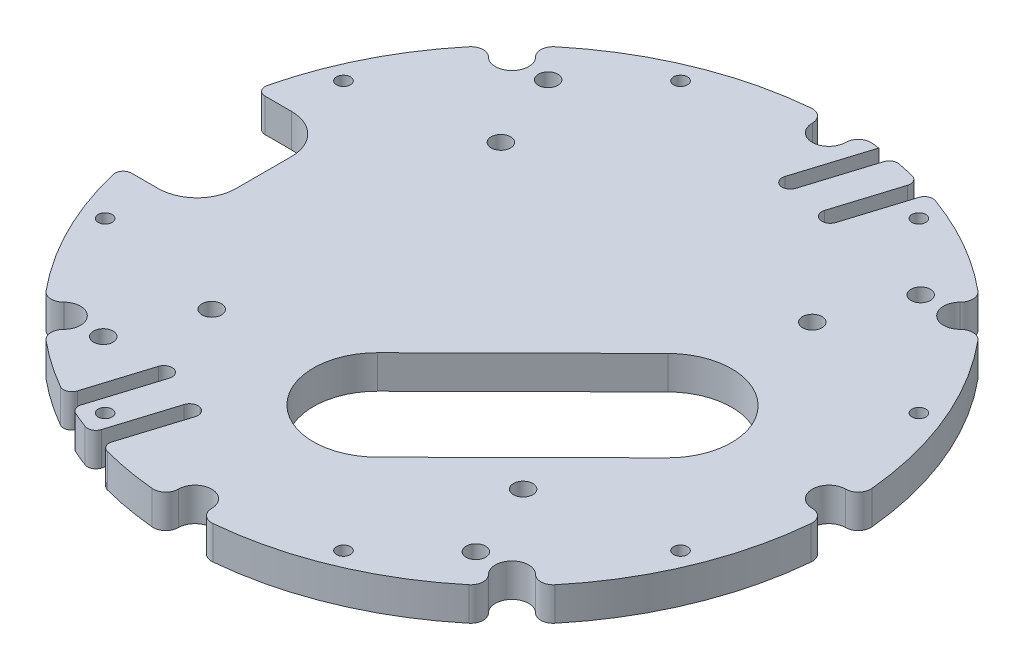
from build123d import *

# Parameters (mm, degrees)
SKIZZE1_R                       = 1.75
SKIZZE1_R_2                     = 1.25
AUFSATZ_LINEAR_AUSTRAGEN1_DEPTH = 6
SKIZZE2_R                       = 45
SKIZZE2_R_2                     = 43
SCHNITT_LINEAR_AUSTRAGEN1_DEPTH = 2
SCHNITT_LINEAR_AUSTRAGEN2_DEPTH = 184.594420289
VERRUNDUNG3_R                   = 1.5
VERRUNDUNG4_R                   = 1.5


with BuildPart() as part:
    # Skizze1 → Aufsatz-Linear austragen1 (new body)
    with BuildSketch(Plane(origin=(0, 90.400052662, 0), x_dir=(1, 0, 0), z_dir=(0, 1, 0))):
        with BuildLine():
            ThreePointArc((59.79229691, -34.576989423), (56.868043497, -33.855483754), (53.911025142, -33.282883624))
            Line((53.911025142, -33.282883624), (49.393275328, -47.783503714))
            ThreePointArc((49.393275328, -47.783503714), (47.883262768, -47.628044266), (46.36882647, -47.52417766))
            Line((46.36882647, -47.52417766), (50.937032463, -32.861608388))
            ThreePointArc((50.937032463, -32.861608388), (9.214097469, -43.752243823), (-14.195716657, -79.965360883))
            Line((-14.195716657, -79.965360883), (-7.542000561, -79.965360883))
            ThreePointArc((-7.542000561, -79.965360883), (-2.592253093, -82.015613415), (-0.542000561, -86.965360883))
            Line((-0.542000561, -86.965360883), (-0.542000561, -96.965360883))
            ThreePointArc((-0.542000561, -96.965360883), (-2.592253093, -101.915108352), (-7.542000561, -103.965360883))
            Line((-7.542000561, -103.965360883), (-14.195716657, -103.965360883))
            ThreePointArc((-14.195716657, -103.965360883), (-3.548828311, -127.624703737), (16.154215433, -144.504004759))
            Line((16.154215433, -144.504004759), (20.722421426, -129.841435487))
            ThreePointArc((20.722421426, -129.841435487), (22.02786149, -130.616117235), (23.358964294, -131.345823271))
            Line((23.358964294, -131.345823271), (18.84121448, -145.846443362))
            ThreePointArc((18.84121448, -145.846443362), (21.600192332, -147.054694026), (24.416778493, -148.121779241))
            Line((24.416778493, -148.121779241), (28.882198324, -133.789122679))
            ThreePointArc((28.882198324, -133.789122679), (30.317535649, -134.283199935), (31.768889486, -134.728034302))
            Line((31.768889486, -134.728034302), (27.306303406, -149.051595373))
            ThreePointArc((27.306303406, -149.051595373), (79.733549202, -139.601389133), (103.581637436, -91.965360883))
            ThreePointArc((103.581637436, -91.965360883), (92.289314353, -57.090299791), (62.69861605, -35.452901131))
            Line((62.69861605, -35.452901131), (58.23602997, -49.776462202))
            ThreePointArc((58.23602997, -49.776462202), (56.788846857, -49.318241066), (55.326877079, -48.909645985))
            Line((55.326877079, -48.909645985), (59.79229691, -34.576989423))
        make_face()
        with Locations(Location((10.581637436, -131.965360883, 0), (0, 0, 270))):
            Circle(SKIZZE1_R, mode=Mode.SUBTRACT)
        with Locations(Location((22.651365223, -143.702614704, 0), (0, 0, 270))):
            Circle(SKIZZE1_R_2, mode=Mode.SUBTRACT)
        with Locations(Location((-7.655616385, -113.395633096, 0), (0, 0, 270))):
            Circle(SKIZZE1_R_2, mode=Mode.SUBTRACT)
        with Locations(Location((16.081637436, -117.965360883, 0), (0, 0, 270))):
            Circle(SKIZZE1_R, mode=Mode.SUBTRACT)
        with Locations(Location((65.511909648, -143.702614704, 0), (0, 0, 270))):
            Circle(SKIZZE1_R_2, mode=Mode.SUBTRACT)
        with Locations(Location((77.581637436, -131.965360883, 0), (0, 0, 270))):
            Circle(SKIZZE1_R, mode=Mode.SUBTRACT)
        with Locations(Location((72.081637436, -117.965360883, 0), (0, 0, 270))):
            Circle(SKIZZE1_R, mode=Mode.SUBTRACT)
        with BuildLine():
            Line((37.760654604, -109.798791244), (63.984901036, -83.798791244))
            ThreePointArc((63.984901036, -83.798791244), (80.248207075, -83.868624484), (80.178373835, -100.131930523))
            Line((80.178373835, -100.131930523), (53.954127402, -126.131930523))
            ThreePointArc((53.954127402, -126.131930523), (37.690821363, -126.062097283), (37.760654604, -109.798791244))
        make_face(mode=Mode.SUBTRACT)
        with Locations(Location((95.818891256, -113.395633096, 0), (0, 0, 270))):
            Circle(SKIZZE1_R_2, mode=Mode.SUBTRACT)
        with Locations(Location((-7.655616385, -70.535088671, 0), (0, 0, 270))):
            Circle(SKIZZE1_R_2, mode=Mode.SUBTRACT)
        with Locations(Location((16.081637436, -65.965360883, 0), (0, 0, 270))):
            Circle(SKIZZE1_R, mode=Mode.SUBTRACT)
        with Locations(Location((10.581637436, -51.965360883, 0), (0, 0, 270))):
            Circle(SKIZZE1_R, mode=Mode.SUBTRACT)
        with Locations(Location((22.651365223, -40.228107063, 0), (0, 0, 270))):
            Circle(SKIZZE1_R_2, mode=Mode.SUBTRACT)
        with Locations(Location((72.081637436, -65.965360883, 0), (0, 0, 270))):
            Circle(SKIZZE1_R, mode=Mode.SUBTRACT)
        with Locations(Location((95.818891256, -70.535088671, 0), (0, 0, 270))):
            Circle(SKIZZE1_R_2, mode=Mode.SUBTRACT)
        with Locations(Location((65.511909648, -40.228107063, 0), (0, 0, 270))):
            Circle(SKIZZE1_R_2, mode=Mode.SUBTRACT)
        with Locations(Location((77.581637436, -51.965360883, 0), (0, 0, 270))):
            Circle(SKIZZE1_R, mode=Mode.SUBTRACT)
    extrude(amount=AUFSATZ_LINEAR_AUSTRAGEN1_DEPTH)

    # Skizze2 → Schnitt-Linear austragen1 (cut)
    with BuildSketch(Plane(origin=(0, 90.400052662, 0), x_dir=(1, 0, 0), z_dir=(0, 1, 0))):
        with Locations((44.081637436, -91.965360883)):
            Circle(SKIZZE2_R)
        with Locations(Location((44.081637436, -91.965360883, 0), (0, 0, 90))):
            Circle(SKIZZE2_R_2, mode=Mode.SUBTRACT)
    extrude(amount=SCHNITT_LINEAR_AUSTRAGEN1_DEPTH, mode=Mode.SUBTRACT)

    # Skizze3 → Schnitt-Linear austragen2 (cut, through all)
    with BuildSketch(Plane(origin=(0, 96.400052662, 0), x_dir=(1, 0, 0), z_dir=(0, 1, 0))):
        with BuildLine():
            ThreePointArc((5.897871252, -49.538954012), (5.238906143, -47.838492112), (6.051282368, -46.20574885))
            ThreePointArc((6.051282368, -46.20574885), (2.008783955, -49.892507403), (-1.677974597, -53.935005816))
            ThreePointArc((-1.677974597, -53.935005816), (-0.045231336, -53.122629591), (1.655230564, -53.781594699))
            ThreePointArc((1.655230564, -53.781594699), (5.897871252, -53.781594699), (5.897871252, -49.538954012))
        make_face()
        with BuildLine():
            ThreePointArc((49.547047449, -32.716906951), (44.081637436, -32.465360883), (38.616227422, -32.716906951))
            ThreePointArc((38.616227422, -32.716906951), (40.345187992, -33.296994046), (41.081637436, -34.965360883))
            ThreePointArc((41.081637436, -34.965360883), (44.081637436, -37.965360883), (47.081637436, -34.965360883))
            ThreePointArc((47.081637436, -34.965360883), (47.81808688, -33.296994046), (49.547047449, -32.716906951))
        make_face()
        with BuildLine():
            ThreePointArc((1.655230564, -130.149127067), (-0.045231336, -130.808092176), (-1.677974597, -129.995715951))
            ThreePointArc((-1.677974597, -129.995715951), (2.008783955, -134.038214364), (6.051282368, -137.724972916))
            ThreePointArc((6.051282368, -137.724972916), (5.238906143, -136.092229655), (5.897871252, -134.391767755))
            ThreePointArc((5.897871252, -134.391767755), (5.897871252, -130.149127067), (1.655230564, -130.149127067))
        make_face()
        with BuildLine():
            ThreePointArc((89.841249469, -53.935005816), (86.154490916, -49.892507403), (82.111992503, -46.20574885))
            ThreePointArc((82.111992503, -46.20574885), (82.924368728, -47.838492112), (82.26540362, -49.538954012))
            ThreePointArc((82.26540362, -49.538954012), (82.26540362, -53.781594699), (86.508044307, -53.781594699))
            ThreePointArc((86.508044307, -53.781594699), (88.208506207, -53.122629591), (89.841249469, -53.935005816))
        make_face()
        with BuildLine():
            ThreePointArc((103.330091368, -97.430770897), (103.581637436, -91.965360883), (103.330091368, -86.49995087))
            ThreePointArc((103.330091368, -86.49995087), (102.750004273, -88.228911439), (101.081637436, -88.965360883))
            ThreePointArc((101.081637436, -88.965360883), (98.081637436, -91.965360883), (101.081637436, -94.965360883))
            ThreePointArc((101.081637436, -94.965360883), (102.750004273, -95.701810327), (103.330091368, -97.430770897))
        make_face()
        with BuildLine():
            ThreePointArc((82.111992503, -137.724972916), (86.154490916, -134.038214364), (89.841249469, -129.995715951))
            ThreePointArc((89.841249469, -129.995715951), (88.208506207, -130.808092176), (86.508044307, -130.149127067))
            ThreePointArc((86.508044307, -130.149127067), (82.26540362, -130.149127067), (82.26540362, -134.391767755))
            ThreePointArc((82.26540362, -134.391767755), (82.924368728, -136.092229655), (82.111992503, -137.724972916))
        make_face()
        with BuildLine():
            ThreePointArc((38.616227422, -151.213814816), (44.081637436, -151.465360883), (49.547047449, -151.213814816))
            ThreePointArc((49.547047449, -151.213814816), (47.81808688, -150.633727721), (47.081637436, -148.965360883))
            ThreePointArc((47.081637436, -148.965360883), (44.081637436, -145.965360883), (41.081637436, -148.965360883))
            ThreePointArc((41.081637436, -148.965360883), (40.345187992, -150.633727721), (38.616227422, -151.213814816))
        make_face()
    extrude(amount=-SCHNITT_LINEAR_AUSTRAGEN2_DEPTH, mode=Mode.SUBTRACT)

    # Verrundung3
    # the kernel refuses this fillet: 1.5 mm, written as the material it adds along each edge
    with BuildSketch(Plane(origin=(20.722421426, 87.672861627, 129.841435487), x_dir=(-0.2974534732108493, 0, 0.9547363150497642), z_dir=(0, 1, 0))) as verrundung3_piece_1_section:
        with BuildLine():
            CenterArc((1.890876414, 1.5), VERRUNDUNG3_R, 168.036182017, 101.963817983)
            ThreePointArc((0.423458363, 1.810940931), (0.221190811, 0.903258021), (0, 0))
            Line((0, 0), (1.890876414, 0))
        make_face()
    verrundung3_piece_1 = extrude(amount=8.727191035, mode=Mode.PRIVATE)
    verrundung3_piece_1 = split(verrundung3_piece_1, bisect_by=Plane(origin=(20.59371333, 92.400052662, 130.786748956), z_dir=(0, -1, 0)), keep=Keep.TOP, mode=Mode.PRIVATE)
    verrundung3_piece_1 = verrundung3_piece_1 - Plane(origin=(44.081637436, 91.400052662, 91.965360883), x_dir=(1, 0, 0), z_dir=(0, -1, 0)) * Cylinder(45, 26, mode=Mode.PRIVATE)
    verrundung3_piece_1 = split(verrundung3_piece_1, bisect_by=Plane(origin=(20.59371333, 90.400052662, 130.786748956), z_dir=(0, 1, 0)), keep=Keep.TOP, mode=Mode.PRIVATE)
    add(verrundung3_piece_1)
    with BuildSketch(Plane(origin=(20.722421426, 92.400052662, 129.841435487), x_dir=(-0.2974534732108493, 0, 0.9547363150497642), z_dir=(0, 1, 0))) as verrundung3_piece_2_section:
        with BuildLine():
            CenterArc((1.890876414, 1.5), VERRUNDUNG3_R, 168.036182017, 101.963817983)
            ThreePointArc((0.423458363, 1.810940931), (0.221190811, 0.903258021), (0, 0))
            Line((0, 0), (1.890876414, 0))
        make_face()
    verrundung3_piece_2 = extrude(amount=4, mode=Mode.PRIVATE)
    verrundung3_piece_2 = verrundung3_piece_2 - Plane(origin=(44.081637436, 94.400052662, 91.965360883), x_dir=(1, 0, 0), z_dir=(0, -1, 0)) * Cylinder(45, 16, mode=Mode.PRIVATE)
    add(verrundung3_piece_2)
    with BuildSketch(Plane(origin=(20.722421426, 92.400052662, 129.841435487), x_dir=(-0.2974534732108493, 0, 0.9547363150497642), z_dir=(0, 1, 0))) as verrundung3_piece_3_section:
        with BuildLine():
            CenterArc((1.890876414, 1.5), VERRUNDUNG3_R, 168.036182017, 101.963817983)
            ThreePointArc((0.423458363, 1.810940931), (0.221190811, 0.903258021), (0, 0))
            Line((0, 0), (1.890876414, 0))
        make_face()
    verrundung3_piece_3 = extrude(amount=4, mode=Mode.PRIVATE)
    verrundung3_piece_3 = verrundung3_piece_3 & Plane(origin=(44.081637436, 94.400052662, 91.965360883), x_dir=(1, 0, 0), z_dir=(0, -1, 0)) * Cylinder(45, 16, mode=Mode.PRIVATE)
    add(verrundung3_piece_3)
    with BuildSketch(Plane(origin=(28.882198324, 88.538383071, 133.789122679), x_dir=(-0.2974534732108456, 0, 0.9547363150497653), z_dir=(0, 1, 0))) as verrundung3_piece_4_section:
        with BuildLine():
            CenterArc((1.544667837, 1.5), VERRUNDUNG3_R, 179.288974409, 90.711025591)
            ThreePointArc((0.044783336, 1.518614129), (0.028873015, 0.759115932), (0, 0))
            Line((0, 0), (1.544667837, 0))
        make_face()
    verrundung3_piece_4 = extrude(amount=7.861669591, mode=Mode.PRIVATE)
    verrundung3_piece_4 = split(verrundung3_piece_4, bisect_by=Plane(origin=(28.730585251, 92.400052662, 134.590351388), z_dir=(0, -1, 0)), keep=Keep.TOP, mode=Mode.PRIVATE)
    verrundung3_piece_4 = verrundung3_piece_4 - Plane(origin=(44.081637436, 91.400052662, 91.965360883), x_dir=(1, 0, 0), z_dir=(0, -1, 0)) * Cylinder(45, 22, mode=Mode.PRIVATE)
    verrundung3_piece_4 = split(verrundung3_piece_4, bisect_by=Plane(origin=(28.730585251, 90.400052662, 134.590351388), z_dir=(0, 1, 0)), keep=Keep.TOP, mode=Mode.PRIVATE)
    add(verrundung3_piece_4)
    with BuildSketch(Plane(origin=(28.882198324, 92.400052662, 133.789122679), x_dir=(-0.2974534732108456, 0, 0.9547363150497653), z_dir=(0, 1, 0))) as verrundung3_piece_5_section:
        with BuildLine():
            CenterArc((1.544667837, 1.5), VERRUNDUNG3_R, 179.288974409, 90.711025591)
            ThreePointArc((0.044783336, 1.518614129), (0.028873015, 0.759115932), (0, 0))
            Line((0, 0), (1.544667837, 0))
        make_face()
    verrundung3_piece_5 = extrude(amount=4, mode=Mode.PRIVATE)
    verrundung3_piece_5 = verrundung3_piece_5 - Plane(origin=(44.081637436, 94.400052662, 91.965360883), x_dir=(1, 0, 0), z_dir=(0, -1, 0)) * Cylinder(45, 15, mode=Mode.PRIVATE)
    add(verrundung3_piece_5)
    with BuildSketch(Plane(origin=(28.882198324, 92.400052662, 133.789122679), x_dir=(-0.2974534732108456, 0, 0.9547363150497653), z_dir=(0, 1, 0))) as verrundung3_piece_6_section:
        with BuildLine():
            CenterArc((1.544667837, 1.5), VERRUNDUNG3_R, 179.288974409, 90.711025591)
            ThreePointArc((0.044783336, 1.518614129), (0.028873015, 0.759115932), (0, 0))
            Line((0, 0), (1.544667837, 0))
        make_face()
    verrundung3_piece_6 = extrude(amount=4, mode=Mode.PRIVATE)
    verrundung3_piece_6 = verrundung3_piece_6 & Plane(origin=(44.081637436, 94.400052662, 91.965360883), x_dir=(1, 0, 0), z_dir=(0, -1, 0)) * Cylinder(45, 15, mode=Mode.PRIVATE)
    add(verrundung3_piece_6)
    with BuildSketch(Plane(origin=(31.768889486, 88.631713171, 134.728034302), x_dir=(-0.2974534732108403, 0, 0.954736315049767), z_dir=(0, 1, 0))) as verrundung3_piece_7_section:
        with BuildLine():
            CenterArc((1.507335797, -1.5), VERRUNDUNG3_R, 90, 89.33296008)
            ThreePointArc((0.007437448, -1.48253733), (0.009893154, -0.74123769), (0, 0))
            Line((0, 0), (1.507335797, 0))
        make_face()
    verrundung3_piece_7 = extrude(amount=7.768339491, mode=Mode.PRIVATE)
    verrundung3_piece_7 = split(verrundung3_piece_7, bisect_by=Plane(origin=(31.448685925, 92.400052662, 135.464823117), z_dir=(0, -1, 0)), keep=Keep.TOP, mode=Mode.PRIVATE)
    verrundung3_piece_7 = verrundung3_piece_7 - Plane(origin=(44.081637436, 91.400052662, 91.965360883), x_dir=(1, 0, 0), z_dir=(0, -1, 0)) * Cylinder(45, 22, mode=Mode.PRIVATE)
    verrundung3_piece_7 = split(verrundung3_piece_7, bisect_by=Plane(origin=(31.448685925, 90.400052662, 135.464823117), z_dir=(0, 1, 0)), keep=Keep.TOP, mode=Mode.PRIVATE)
    add(verrundung3_piece_7)
    with BuildSketch(Plane(origin=(31.768889486, 92.400052662, 134.728034302), x_dir=(-0.2974534732108424, 0, 0.9547363150497663), z_dir=(0, 1, 0))) as verrundung3_piece_8_section:
        with BuildLine():
            CenterArc((1.507335797, -1.5), VERRUNDUNG3_R, 90, 89.33296008)
            ThreePointArc((0.007437448, -1.48253733), (0.009893154, -0.74123769), (0, 0))
            Line((0, 0), (1.507335797, 0))
        make_face()
    verrundung3_piece_8 = extrude(amount=4, mode=Mode.PRIVATE)
    verrundung3_piece_8 = verrundung3_piece_8 - Plane(origin=(44.081637436, 94.400052662, 91.965360883), x_dir=(1, 0, 0), z_dir=(0, -1, 0)) * Cylinder(45, 15, mode=Mode.PRIVATE)
    add(verrundung3_piece_8)
    with BuildSketch(Plane(origin=(31.768889486, 92.400052662, 134.728034302), x_dir=(-0.2974534732108424, 0, 0.9547363150497663), z_dir=(0, 1, 0))) as verrundung3_piece_9_section:
        with BuildLine():
            CenterArc((1.507335797, -1.5), VERRUNDUNG3_R, 90, 89.33296008)
            ThreePointArc((0.007437448, -1.48253733), (0.009893154, -0.74123769), (0, 0))
            Line((0, 0), (1.507335797, 0))
        make_face()
    verrundung3_piece_9 = extrude(amount=4, mode=Mode.PRIVATE)
    verrundung3_piece_9 = verrundung3_piece_9 & Plane(origin=(44.081637436, 94.400052662, 91.965360883), x_dir=(1, 0, 0), z_dir=(0, -1, 0)) * Cylinder(45, 15, mode=Mode.PRIVATE)
    add(verrundung3_piece_9)
    with BuildSketch(Plane(origin=(23.358964294, 89.321715781, 131.345823271), x_dir=(-0.878535429399304, 0, -0.47767719151136007), z_dir=(0, 1, 0))) as verrundung3_piece_10_section:
        with BuildLine():
            CenterArc((1.231503921, 1.499861115), VERRUNDUNG3_R, 191.229088465, 77.991219215)
            Line((-0.239780706, 1.207762595), (0, 0))
            ThreePointArc((0, 0), (0.605546127, 0.004120259), (1.211092254, 0))
        make_face()
    verrundung3_piece_10 = extrude(amount=7.078336881, mode=Mode.PRIVATE)
    verrundung3_piece_10 = split(verrundung3_piece_10, bisect_by=Plane(origin=(23.105067075, 92.400052662, 132.036463955), z_dir=(0, -1, 0)), keep=Keep.TOP, mode=Mode.PRIVATE)
    verrundung3_piece_10 = verrundung3_piece_10 - Plane(origin=(44.081637436, 91.400052662, 91.965360883), x_dir=(1, 0, 0), z_dir=(0, -1, 0)) * Cylinder(45, 20, mode=Mode.PRIVATE)
    verrundung3_piece_10 = split(verrundung3_piece_10, bisect_by=Plane(origin=(23.105067075, 90.400052662, 132.036463955), z_dir=(0, 1, 0)), keep=Keep.TOP, mode=Mode.PRIVATE)
    add(verrundung3_piece_10)
    with BuildSketch(Plane(origin=(23.358964294, 92.400052662, 131.345823271), x_dir=(-0.878535429399304, 0, -0.47767719151136007), z_dir=(0, 1, 0))) as verrundung3_piece_11_section:
        with BuildLine():
            CenterArc((1.231503921, 1.499861115), VERRUNDUNG3_R, 191.229088465, 77.991219215)
            Line((-0.239780706, 1.207762595), (0, 0))
            ThreePointArc((0, 0), (0.605546127, 0.004120259), (1.211092254, 0))
        make_face()
    verrundung3_piece_11 = extrude(amount=4, mode=Mode.PRIVATE)
    verrundung3_piece_11 = verrundung3_piece_11 & Plane(origin=(44.081637436, 94.400052662, 91.965360883), x_dir=(1, 0, 0), z_dir=(0, -1, 0)) * Cylinder(45, 13, mode=Mode.PRIVATE)
    add(verrundung3_piece_11)
    with BuildSketch(Plane(origin=(23.358964294, 92.400052662, 131.345823271), x_dir=(-0.878535429399304, 0, -0.47767719151136007), z_dir=(0, 1, 0))) as verrundung3_piece_12_section:
        with BuildLine():
            CenterArc((1.231503921, 1.499861115), VERRUNDUNG3_R, 191.229088465, 77.991219215)
            Line((-0.239780706, 1.207762595), (0, 0))
            ThreePointArc((0, 0), (0.605546127, 0.004120259), (1.211092254, 0))
        make_face()
    verrundung3_piece_12 = extrude(amount=4, mode=Mode.PRIVATE)
    verrundung3_piece_12 = verrundung3_piece_12 - Plane(origin=(44.081637436, 94.400052662, 91.965360883), x_dir=(1, 0, 0), z_dir=(0, -1, 0)) * Cylinder(45, 13, mode=Mode.PRIVATE)
    add(verrundung3_piece_12)
    with BuildSketch(Plane(origin=(55.326877079, 88.538383071, 48.909645985), x_dir=(0.2974534732108461, 0, -0.9547363150497651), z_dir=(0, 1, 0))) as verrundung3_piece_13_section:
        with BuildLine():
            CenterArc((1.544667837, -1.5), VERRUNDUNG3_R, 90, 90.711025591)
            ThreePointArc((0.044783336, -1.518614129), (0.028873015, -0.759115932), (0, 0))
            Line((0, 0), (1.544667837, 0))
        make_face()
    verrundung3_piece_13 = extrude(amount=7.861669591, mode=Mode.PRIVATE)
    verrundung3_piece_13 = split(verrundung3_piece_13, bisect_by=Plane(origin=(55.657174315, 92.400052662, 48.164087333), z_dir=(0, -1, 0)), keep=Keep.TOP, mode=Mode.PRIVATE)
    verrundung3_piece_13 = verrundung3_piece_13 - Plane(origin=(44.081637436, 91.400052662, 91.965360883), x_dir=(1, 0, 0), z_dir=(0, -1, 0)) * Cylinder(45, 22, mode=Mode.PRIVATE)
    verrundung3_piece_13 = split(verrundung3_piece_13, bisect_by=Plane(origin=(55.657174315, 90.400052662, 48.164087333), z_dir=(0, 1, 0)), keep=Keep.TOP, mode=Mode.PRIVATE)
    add(verrundung3_piece_13)
    with BuildSketch(Plane(origin=(55.326877079, 92.400052662, 48.909645985), x_dir=(0.297453473210849, 0, -0.9547363150497642), z_dir=(0, 1, 0))) as verrundung3_piece_14_section:
        with BuildLine():
            CenterArc((1.544667837, -1.5), VERRUNDUNG3_R, 90, 90.711025591)
            ThreePointArc((0.044783336, -1.518614129), (0.028873015, -0.759115932), (0, 0))
            Line((0, 0), (1.544667837, 0))
        make_face()
    verrundung3_piece_14 = extrude(amount=4, mode=Mode.PRIVATE)
    verrundung3_piece_14 = verrundung3_piece_14 - Plane(origin=(44.081637436, 94.400052662, 91.965360883), x_dir=(1, 0, 0), z_dir=(0, -1, 0)) * Cylinder(45, 15, mode=Mode.PRIVATE)
    add(verrundung3_piece_14)
    with BuildSketch(Plane(origin=(55.326877079, 92.400052662, 48.909645985), x_dir=(0.297453473210849, 0, -0.9547363150497642), z_dir=(0, 1, 0))) as verrundung3_piece_15_section:
        with BuildLine():
            CenterArc((1.544667837, -1.5), VERRUNDUNG3_R, 90, 90.711025591)
            ThreePointArc((0.044783336, -1.518614129), (0.028873015, -0.759115932), (0, 0))
            Line((0, 0), (1.544667837, 0))
        make_face()
    verrundung3_piece_15 = extrude(amount=4, mode=Mode.PRIVATE)
    verrundung3_piece_15 = verrundung3_piece_15 & Plane(origin=(44.081637436, 94.400052662, 91.965360883), x_dir=(1, 0, 0), z_dir=(0, -1, 0)) * Cylinder(45, 15, mode=Mode.PRIVATE)
    add(verrundung3_piece_15)
    with BuildSketch(Plane(origin=(46.36882647, 87.672861627, 47.52417766), x_dir=(0.9973861772559938, 0, 0.07225519648215907), z_dir=(0, 1, 0))) as verrundung3_piece_16_section:
        with BuildLine():
            CenterArc((1.891136196, 1.499672465), VERRUNDUNG3_R, 166.838811743, 101.963817983)
            Line((0.430536151, 1.841209449), (0, 0))
            ThreePointArc((0, 0), (0.929895698, 0.009716859), (1.859791397, 0))
        make_face()
    verrundung3_piece_16 = extrude(amount=8.727191035, mode=Mode.PRIVATE)
    verrundung3_piece_16 = split(verrundung3_piece_16, bisect_by=Plane(origin=(46.79981264, 92.400052662, 46.673040626), z_dir=(0, -1, 0)), keep=Keep.TOP, mode=Mode.PRIVATE)
    verrundung3_piece_16 = verrundung3_piece_16 - Plane(origin=(44.081637436, 91.400052662, 91.965360883), x_dir=(1, 0, 0), z_dir=(0, -1, 0)) * Cylinder(45, 25, mode=Mode.PRIVATE)
    verrundung3_piece_16 = split(verrundung3_piece_16, bisect_by=Plane(origin=(46.79981264, 90.400052662, 46.673040626), z_dir=(0, 1, 0)), keep=Keep.TOP, mode=Mode.PRIVATE)
    add(verrundung3_piece_16)
    with BuildSketch(Plane(origin=(46.36882647, 92.400052662, 47.52417766), x_dir=(0.9973861772559935, 0, 0.0722551964821622), z_dir=(0, 1, 0))) as verrundung3_piece_17_section:
        with BuildLine():
            CenterArc((1.891136196, 1.499672465), VERRUNDUNG3_R, 166.838811743, 101.963817983)
            Line((0.430536151, 1.841209449), (0, 0))
            ThreePointArc((0, 0), (0.929895698, 0.009716859), (1.859791397, 0))
        make_face()
    verrundung3_piece_17 = extrude(amount=4, mode=Mode.PRIVATE)
    verrundung3_piece_17 = verrundung3_piece_17 & Plane(origin=(44.081637436, 94.400052662, 91.965360883), x_dir=(1, 0, 0), z_dir=(0, -1, 0)) * Cylinder(45, 16, mode=Mode.PRIVATE)
    add(verrundung3_piece_17)
    with BuildSketch(Plane(origin=(46.36882647, 92.400052662, 47.52417766), x_dir=(0.9973861772559935, 0, 0.0722551964821622), z_dir=(0, 1, 0))) as verrundung3_piece_18_section:
        with BuildLine():
            CenterArc((1.891136196, 1.499672465), VERRUNDUNG3_R, 166.838811743, 101.963817983)
            Line((0.430536151, 1.841209449), (0, 0))
            ThreePointArc((0, 0), (0.929895698, 0.009716859), (1.859791397, 0))
        make_face()
    verrundung3_piece_18 = extrude(amount=4, mode=Mode.PRIVATE)
    verrundung3_piece_18 = verrundung3_piece_18 - Plane(origin=(44.081637436, 94.400052662, 91.965360883), x_dir=(1, 0, 0), z_dir=(0, -1, 0)) * Cylinder(45, 16, mode=Mode.PRIVATE)
    add(verrundung3_piece_18)
    with BuildSketch(Plane(origin=(49.393275328, 89.321715781, 47.783503714), x_dir=(0.2974534732108457, 0, -0.9547363150497654), z_dir=(0, 1, 0))) as verrundung3_piece_19_section:
        with BuildLine():
            CenterArc((1.231334752, 1.5), VERRUNDUNG3_R, 192.008780785, 77.991219215)
            ThreePointArc((-0.235838837, 1.18790761), (-0.113878036, 0.594756153), (0, 0))
            Line((0, 0), (1.231334752, 0))
        make_face()
    verrundung3_piece_19 = extrude(amount=7.078336881, mode=Mode.PRIVATE)
    verrundung3_piece_19 = split(verrundung3_piece_19, bisect_by=Plane(origin=(49.576576622, 92.400052662, 47.070868473), z_dir=(0, -1, 0)), keep=Keep.TOP, mode=Mode.PRIVATE)
    verrundung3_piece_19 = verrundung3_piece_19 - Plane(origin=(44.081637436, 91.400052662, 91.965360883), x_dir=(1, 0, 0), z_dir=(0, -1, 0)) * Cylinder(45, 20, mode=Mode.PRIVATE)
    verrundung3_piece_19 = split(verrundung3_piece_19, bisect_by=Plane(origin=(49.576576622, 90.400052662, 47.070868473), z_dir=(0, 1, 0)), keep=Keep.TOP, mode=Mode.PRIVATE)
    add(verrundung3_piece_19)
    with BuildSketch(Plane(origin=(49.393275328, 92.400052662, 47.783503714), x_dir=(0.2974534732108457, 0, -0.9547363150497654), z_dir=(0, 1, 0))) as verrundung3_piece_20_section:
        with BuildLine():
            CenterArc((1.231334752, 1.5), VERRUNDUNG3_R, 192.008780785, 77.991219215)
            ThreePointArc((-0.235838837, 1.18790761), (-0.113878036, 0.594756153), (0, 0))
            Line((0, 0), (1.231334752, 0))
        make_face()
    verrundung3_piece_20 = extrude(amount=4, mode=Mode.PRIVATE)
    verrundung3_piece_20 = verrundung3_piece_20 - Plane(origin=(44.081637436, 94.400052662, 91.965360883), x_dir=(1, 0, 0), z_dir=(0, -1, 0)) * Cylinder(45, 13, mode=Mode.PRIVATE)
    add(verrundung3_piece_20)
    with BuildSketch(Plane(origin=(49.393275328, 92.400052662, 47.783503714), x_dir=(0.2974534732108457, 0, -0.9547363150497654), z_dir=(0, 1, 0))) as verrundung3_piece_21_section:
        with BuildLine():
            CenterArc((1.231334752, 1.5), VERRUNDUNG3_R, 192.008780785, 77.991219215)
            ThreePointArc((-0.235838837, 1.18790761), (-0.113878036, 0.594756153), (0, 0))
            Line((0, 0), (1.231334752, 0))
        make_face()
    verrundung3_piece_21 = extrude(amount=4, mode=Mode.PRIVATE)
    verrundung3_piece_21 = verrundung3_piece_21 & Plane(origin=(44.081637436, 94.400052662, 91.965360883), x_dir=(1, 0, 0), z_dir=(0, -1, 0)) * Cylinder(45, 13, mode=Mode.PRIVATE)
    add(verrundung3_piece_21)
    with BuildSketch(Plane(origin=(58.23602997, 88.631713171, 49.776462202), x_dir=(-0.9532320845048395, 0, -0.3022392976939934), z_dir=(0, 1, 0))) as verrundung3_piece_22_section:
        with BuildLine():
            CenterArc((1.507542884, -1.499791871), VERRUNDUNG3_R, 90.954473369, 89.33296008)
            Line((0.00756176, -1.507316829), (0, 0))
            ThreePointArc((0, 0), (0.741277993, -0.006174508), (1.482555986, 0))
        make_face()
    verrundung3_piece_22 = extrude(amount=7.768339491, mode=Mode.PRIVATE)
    verrundung3_piece_22 = split(verrundung3_piece_22, bisect_by=Plane(origin=(58.390969485, 92.400052662, 48.988184443), z_dir=(0, -1, 0)), keep=Keep.TOP, mode=Mode.PRIVATE)
    verrundung3_piece_22 = verrundung3_piece_22 - Plane(origin=(44.081637436, 91.400052662, 91.965360883), x_dir=(1, 0, 0), z_dir=(0, -1, 0)) * Cylinder(45, 22, mode=Mode.PRIVATE)
    verrundung3_piece_22 = split(verrundung3_piece_22, bisect_by=Plane(origin=(58.390969485, 90.400052662, 48.988184443), z_dir=(0, 1, 0)), keep=Keep.TOP, mode=Mode.PRIVATE)
    add(verrundung3_piece_22)
    with BuildSketch(Plane(origin=(58.23602997, 92.400052662, 49.776462202), x_dir=(-0.9532320845048383, 0, -0.30223929769399777), z_dir=(0, 1, 0))) as verrundung3_piece_23_section:
        with BuildLine():
            CenterArc((1.507542884, -1.499791871), VERRUNDUNG3_R, 90.954473369, 89.33296008)
            Line((0.00756176, -1.507316829), (0, 0))
            ThreePointArc((0, 0), (0.741277993, -0.006174508), (1.482555986, 0))
        make_face()
    verrundung3_piece_23 = extrude(amount=4, mode=Mode.PRIVATE)
    verrundung3_piece_23 = verrundung3_piece_23 & Plane(origin=(44.081637436, 94.400052662, 91.965360883), x_dir=(1, 0, 0), z_dir=(0, -1, 0)) * Cylinder(45, 15, mode=Mode.PRIVATE)
    add(verrundung3_piece_23)
    with BuildSketch(Plane(origin=(58.23602997, 92.400052662, 49.776462202), x_dir=(-0.9532320845048383, 0, -0.30223929769399777), z_dir=(0, 1, 0))) as verrundung3_piece_24_section:
        with BuildLine():
            CenterArc((1.507542884, -1.499791871), VERRUNDUNG3_R, 90.954473369, 89.33296008)
            Line((0.00756176, -1.507316829), (0, 0))
            ThreePointArc((0, 0), (0.741277993, -0.006174508), (1.482555986, 0))
        make_face()
    verrundung3_piece_24 = extrude(amount=4, mode=Mode.PRIVATE)
    verrundung3_piece_24 = verrundung3_piece_24 - Plane(origin=(44.081637436, 94.400052662, 91.965360883), x_dir=(1, 0, 0), z_dir=(0, -1, 0)) * Cylinder(45, 15, mode=Mode.PRIVATE)
    add(verrundung3_piece_24)
    # the kernel refuses this fillet: 1.5 mm, written as the material it takes off along each edge
    with BuildSketch(Plane(origin=(27.306303406, 86.489026185, 149.051595373), x_dir=(0.9630560504228445, 0, 0.2693010281152889), z_dir=(0, 1, 0))) as verrundung3_2_piece_1:
        with BuildLine():
            CenterArc((1.544691129, 1.499870375), VERRUNDUNG3_R, 178.317961352, 92.435288281)
            Line((0.045337463, 1.543899719), (0, 0))
            ThreePointArc((0, 0), (0.782205295, -0.005141778), (1.564410591, 0))
        make_face()
    extrude(amount=13.822052954, mode=Mode.SUBTRACT)
    with BuildSketch(Plane(origin=(24.416778493, 86.41454954, 148.121779241), x_dir=(0.2974534732108463, 0, -0.9547363150497651), z_dir=(0, 1, 0))) as verrundung3_2_piece_2:
        with BuildLine():
            CenterArc((1.573978004, 1.5), VERRUNDUNG3_R, 176.470290599, 93.529709401)
            ThreePointArc((0.076823491, 1.592349137), (0.03307847, 0.796431874), (0, 0))
            Line((0, 0), (1.573978004, 0))
        make_face()
    extrude(amount=13.971006243, mode=Mode.SUBTRACT)
    with BuildSketch(Plane(origin=(18.84121448, 87.048827628, 145.846443362), x_dir=(0.910285506913091, 0, 0.41398103326599045), z_dir=(0, 1, 0))) as verrundung3_2_piece_3:
        with BuildLine():
            CenterArc((1.323593081, 1.499904828), VERRUNDUNG3_R, 187.15044683, 83.494982117)
            Line((-0.164741009, 1.313192117), (0, 0))
            ThreePointArc((0, 0), (0.670245007, -0.003775148), (1.340490014, 0))
        make_face()
    extrude(amount=12.702450069, mode=Mode.SUBTRACT)
    with BuildSketch(Plane(origin=(16.154215433, 85.744724027, 144.504004759), x_dir=(0.29745347321083987, 0, -0.9547363150497671), z_dir=(0, 1, 0))) as verrundung3_2_piece_4:
        with BuildLine():
            CenterArc((1.83850938, 1.5), VERRUNDUNG3_R, 167.518187982, 102.481812018)
            ThreePointArc((0.373962383, 1.824194531), (0.179844431, 0.913560311), (0, 0))
            Line((0, 0), (1.83850938, 0))
        make_face()
    extrude(amount=15.310657269, mode=Mode.SUBTRACT)
    with BuildSketch(Plane(origin=(53.911025142, 87.048827628, 33.282883624), x_dir=(0.9843366326867173, 0, 0.1762991592463628), z_dir=(0, 1, 0))) as verrundung3_2_piece_5:
        with BuildLine():
            CenterArc((1.323593081, -1.499904828), VERRUNDUNG3_R, 89.354571053, 83.494982117)
            Line((-0.164741009, -1.313192117), (0, 0))
            ThreePointArc((0, 0), (0.670245007, 0.003775148), (1.340490014, 0))
        make_face()
    extrude(amount=12.702450069, mode=Mode.SUBTRACT)
    with BuildSketch(Plane(origin=(59.79229691, 86.41454954, 34.576989423), x_dir=(-0.29745347321084553, 0, 0.9547363150497654), z_dir=(0, 1, 0))) as verrundung3_2_piece_6:
        with BuildLine():
            CenterArc((1.573978004, -1.5), VERRUNDUNG3_R, 90, 93.529709401)
            ThreePointArc((0.076823491, -1.592349137), (0.03307847, -0.796431874), (0, 0))
            Line((0, 0), (1.573978004, 0))
        make_face()
    extrude(amount=13.971006243, mode=Mode.SUBTRACT)
    with BuildSketch(Plane(origin=(62.69861605, 86.489026185, 35.452901131), x_dir=(0.9455938087703508, 0, 0.32534957939911524), z_dir=(0, 1, 0))) as verrundung3_2_piece_7:
        with BuildLine():
            CenterArc((1.544691129, -1.499870375), VERRUNDUNG3_R, 89.246750367, 92.435288281)
            Line((0.045337463, -1.543899719), (0, 0))
            ThreePointArc((0, 0), (0.782205295, 0.005141778), (1.564410591, 0))
        make_face()
    extrude(amount=13.822052954, mode=Mode.SUBTRACT)

    # Verrundung4
    verrundung4_edges = [part.edges().sort_by_distance(p)[0] for p in [
        (-14.195716657, 93.400052662, 79.965360883),
        (-14.195716657, 93.400052662, 103.965360883),
    ]]
    fillet(verrundung4_edges, radius=VERRUNDUNG4_R)


solid = part.part
